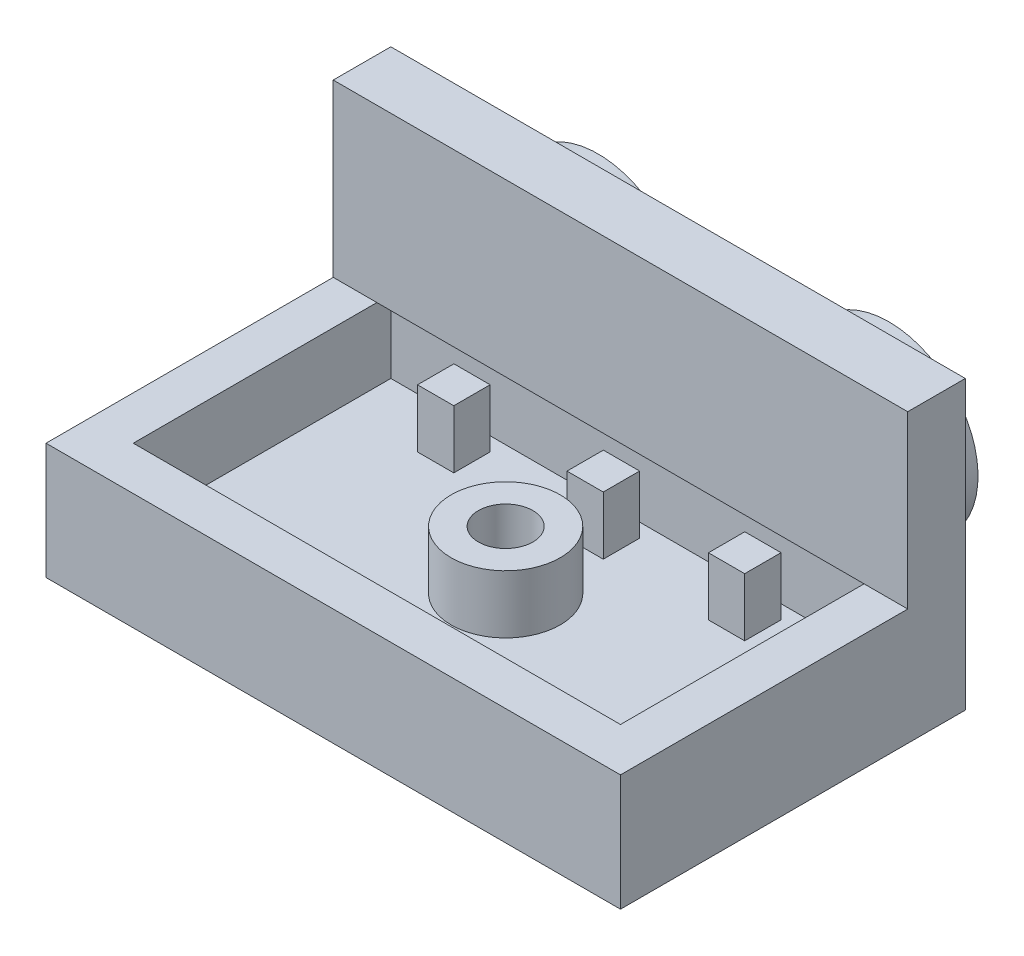
from build123d import *

# Parameters (mm, degrees)
MAINBASESKETCH_W             = 15.8
MAINBASESKETCH_H             = 3.2
MAINBASEEXTRUDE_DEPTH        = 7.9
LCUTBLUE_DEPTH               = 19.555463972
LCUTBLUE_DEPTH_BACK          = 19.555463972
MADESLIMCUTSKETCH_W          = 7.9
MADESLIMCUTSKETCH_H          = 7.9
MADESLIMCUT_DEPTH            = 19.555463972
SHORTLEXTENSIONSKETCH_W      = 1.583745828
SHORTLEXTENSIONSKETCH_H      = 7.9
SHORTLUPPERCIRCLES_START     = -0.2
SHORTLUPPERCIRCLESSKETCH_R   = 2.45
SHORTLUPPERCIRCLESSKETCH_R_2 = 2
SHORTLUPPERCIRCLES_DEPTH     = 2
SHELL1_START                 = 1.2
SHELL1_OUTLINE_W             = 13.4
SHELL1_OUTLINE_H             = 7.083745828
SHELL1_DEPTH                 = 2
BOSS_EXTRUDE4_REACH          = 21.272
BOSS_EXTRUDE4_START          = -0.4
SKETCH89_R                   = 1.5
SKETCH89_R_2                 = 0.75
SKETCH89_W                   = 0.996828099
SKETCH89_H                   = 1
SKETCH89_W_2                 = 0.996828098
SKETCH90_R                   = 2.4
BOSS_EXTRUDE5_DEPTH          = 1.5


# Read off the part's stored shape, not the designer's step: Shell1
with BuildPart() as part:
    # MainBaseSketch → MainBaseExtrude (new, symmetric)
    with BuildSketch(Plane.XY):
        with Locations((8.581967213, 1.6)):
            Rectangle(MAINBASESKETCH_W, MAINBASESKETCH_H)
    extrude(amount=MAINBASEEXTRUDE_DEPTH, both=True)

    # LCUTBlueSketch → LCutBlue (cut, two sides: drawn at the far end of the back side and taken through both)
    with BuildSketch(Plane(origin=(0, 3.2, 0), x_dir=(1, 0, 0), z_dir=(0, 1, 0)).offset(-LCUTBLUE_DEPTH_BACK)):
        Polygon((8.581967213, 53.229874044), (8.581967213, 7.9), (8.581967213, 0), (16.481967213, 0), (61.811841258, 0), (125.917963912, 64.106122654), (72.688089868, 117.335996699), align=None)
    extrude(amount=LCUTBLUE_DEPTH + LCUTBLUE_DEPTH_BACK, mode=Mode.SUBTRACT)

    # MadeSlimCutSketch → MadeSlimCut (cut, through all)
    with BuildSketch(Plane.XZ):
        with Locations((4.631967213, -3.95)):
            Rectangle(MADESLIMCUTSKETCH_W, MADESLIMCUTSKETCH_H)
    extrude(amount=-MADESLIMCUT_DEPTH, mode=Mode.SUBTRACT)

    # ShortLExtension: sweep along a curve in space
    with BuildLine() as shortlextension_path:
        Line((0.681967213, 3.2, 0), (16.481967213, 3.2, 0))
    # ShortLExtensionSketch → ShortLExtension (sweep)
    with BuildSketch(Plane(origin=(16.481967213, 0, 0), x_dir=(0, 0, -1), z_dir=(1, 0, 0))):
        with Locations((0.791872914, 3.95)):
            Rectangle(SHORTLEXTENSIONSKETCH_W, SHORTLEXTENSIONSKETCH_H)
    sweep(path=shortlextension_path.line)

    # ShortLUpperCirclesSketch → ShortLUpperCircles (add)
    # profile 1 of 2: a face of its own
    with BuildSketch(Plane(origin=(0, 0, -1.583745828), x_dir=(-1, 0, 0), z_dir=(0, 0, -1)).offset(SHORTLUPPERCIRCLES_START)):
        with Locations(Location((-12.581967213, 3.95, 0), (0, 0, 90))):
            Circle(SHORTLUPPERCIRCLESSKETCH_R)
        with Locations(Location((-12.581967213, 3.95, 0), (0, 0, 90))):
            Circle(SHORTLUPPERCIRCLESSKETCH_R_2, mode=Mode.SUBTRACT)
    # profile 2 of 2: a face of its own
    with BuildSketch(Plane(origin=(0, 0, -1.583745828), x_dir=(-1, 0, 0), z_dir=(0, 0, -1)).offset(SHORTLUPPERCIRCLES_START)):
        with Locations(Location((-4.581967213, 3.95, 0), (0, 0, 270))):
            Circle(SHORTLUPPERCIRCLESSKETCH_R)
        with Locations(Location((-4.581967213, 3.95, 0), (0, 0, 270))):
            Circle(SHORTLUPPERCIRCLESSKETCH_R_2, mode=Mode.SUBTRACT)
    extrude(amount=SHORTLUPPERCIRCLES_DEPTH)

    # Shell1 outline → Shell1 (cut)
    with BuildSketch(Plane(origin=(0, 0, 0), x_dir=(1, 0, 0), z_dir=(0, 1, 0)).offset(SHELL1_START)):
        with Locations((8.581967213, -3.158127086)):
            Rectangle(SHELL1_OUTLINE_W, SHELL1_OUTLINE_H)
    extrude(amount=SHELL1_DEPTH, mode=Mode.SUBTRACT)

    # Sketch89 → Boss-Extrude4 (add, up to next)
    with BuildSketch(Plane(origin=(0, 3.2, 0), x_dir=(1, 0, 0), z_dir=(0, 1, 0)).offset(BOSS_EXTRUDE4_START), mode=Mode.PRIVATE) as boss_extrude4_sk1:
        with Locations(Location((8.581967213, -3.158127086, 0), (0, 0, 270))):
            Circle(SKETCH89_R)
        with Locations(Location((8.581967213, -3.158127086, 0), (0, 0, 270))):
            Circle(SKETCH89_R_2, mode=Mode.SUBTRACT)
    boss_extrude4_tool1 = extrude(boss_extrude4_sk1.sketch, amount=-BOSS_EXTRUDE4_REACH, mode=Mode.PRIVATE) - part.part
    # Sketch89 → Boss-Extrude4 (add, up to next)
    with BuildSketch(Plane(origin=(0, 3.2, 0), x_dir=(1, 0, 0), z_dir=(0, 1, 0)).offset(BOSS_EXTRUDE4_START), mode=Mode.PRIVATE) as boss_extrude4_sk2:
        with Locations((4.498879862, -0.5)):
            Rectangle(SKETCH89_W, SKETCH89_H)
    boss_extrude4_tool2 = extrude(boss_extrude4_sk2.sketch, amount=-BOSS_EXTRUDE4_REACH, mode=Mode.PRIVATE) - part.part
    # Sketch89 → Boss-Extrude4 (add, up to next)
    with BuildSketch(Plane(origin=(0, 3.2, 0), x_dir=(1, 0, 0), z_dir=(0, 1, 0)).offset(BOSS_EXTRUDE4_START), mode=Mode.PRIVATE) as boss_extrude4_sk3:
        with Locations((8.609734638, -0.5)):
            Rectangle(SKETCH89_W_2, SKETCH89_H)
    boss_extrude4_tool3 = extrude(boss_extrude4_sk3.sketch, amount=-BOSS_EXTRUDE4_REACH, mode=Mode.PRIVATE) - part.part
    # Sketch89 → Boss-Extrude4 (add, up to next)
    with BuildSketch(Plane(origin=(0, 3.2, 0), x_dir=(1, 0, 0), z_dir=(0, 1, 0)).offset(BOSS_EXTRUDE4_START), mode=Mode.PRIVATE) as boss_extrude4_sk4:
        with Locations((12.499284685, -0.5)):
            Rectangle(SKETCH89_W_2, SKETCH89_H)
    boss_extrude4_tool4 = extrude(boss_extrude4_sk4.sketch, amount=-BOSS_EXTRUDE4_REACH, mode=Mode.PRIVATE) - part.part
    add(boss_extrude4_tool1.solids().sort_by_distance((8.581967, 2.8, 1.700553))[0])
    add(boss_extrude4_tool2.solids().sort_by_distance((4.49888, 2.8, 0.5))[0])
    add(boss_extrude4_tool3.solids().sort_by_distance((8.609735, 2.8, 0.5))[0])
    add(boss_extrude4_tool4.solids().sort_by_distance((12.499285, 2.8, 0.5))[0])

    # Sketch90 → Boss-Extrude5 (add)
    with BuildSketch(Plane(origin=(0, 0, 0), x_dir=(-1, 0, 0), z_dir=(0, -1, 0))):
        with Locations(Location((-12.581967213, -3.158127086, 0), (0, 0, 270))):
            Circle(SKETCH90_R)
        with Locations(Location((-4.581967213, -3.158127086, 0), (0, 0, 270))):
            Circle(SKETCH90_R)
    extrude(amount=BOSS_EXTRUDE5_DEPTH)


solid = part.part
